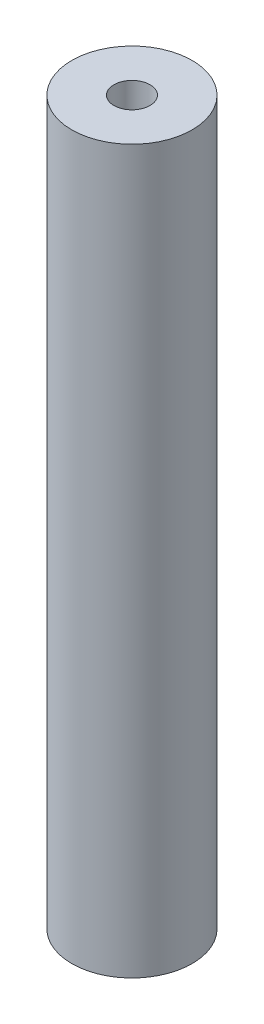
from build123d import *

# Parameters (mm, degrees)
SKETCH1_R           = 5
SKETCH1_R_2         = 1.5
BOSS_EXTRUDE1_DEPTH = 60


with BuildPart() as part:
    # Sketch1 → Boss-Extrude1 (new body)
    with BuildSketch(Plane(origin=(0, 0, 0), x_dir=(1, 0, 0), z_dir=(0, 1, 0))):
        Circle(SKETCH1_R)
        Circle(SKETCH1_R_2, mode=Mode.SUBTRACT)
    extrude(amount=BOSS_EXTRUDE1_DEPTH)


solid = part.part
